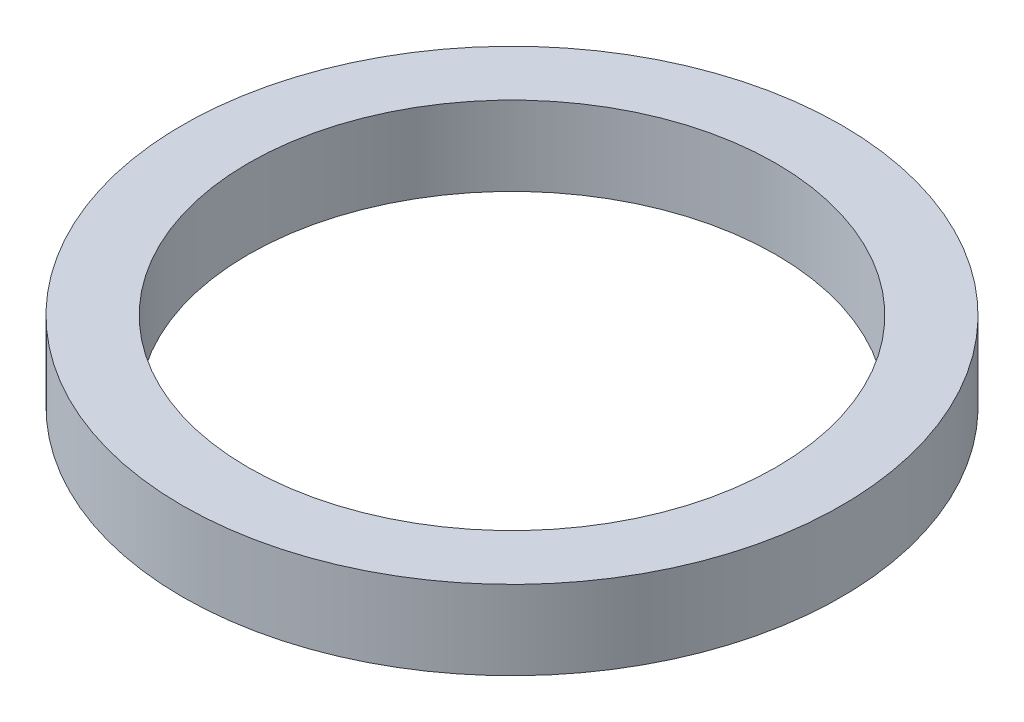
from build123d import *

# Parameters (mm, degrees)
SKETCH1_R           = 25
SKETCH1_R_2         = 20
BOSS_EXTRUDE1_DEPTH = 3


with BuildPart() as part:
    # Sketch1 → Boss-Extrude1 (new, symmetric)
    with BuildSketch(Plane(origin=(0, 0, 0), x_dir=(1, 0, 0), z_dir=(0, 1, 0))):
        Circle(SKETCH1_R)
        Circle(SKETCH1_R_2, mode=Mode.SUBTRACT)
    extrude(amount=BOSS_EXTRUDE1_DEPTH, both=True)


solid = part.part
